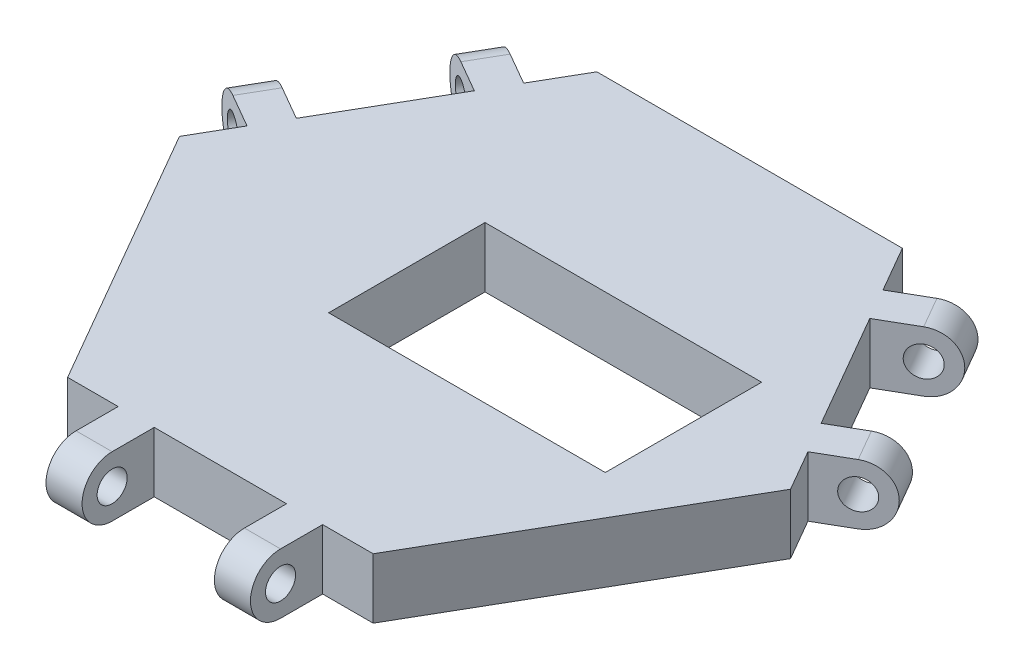
from build123d import *

# Parameters (mm, degrees)
BOSS_EXTRUDE1_DEPTH     = 5
BOSS_EXTRUDE2_START     = 5.5
SKETCH2_R               = 1.25
BOSS_EXTRUDE2_DEPTH     = 3
CIRPATTERN1_START       = -8.29907709
CIRPATTERN1_OUTLINE_R   = 1.25
CIRPATTERN1_DEPTH       = 3
CIRPATTERN1_START_2     = 5.754432
CIRPATTERN1_2_OUTLINE_R = 1.25
CIRPATTERN1_2_DEPTH     = 3
CIRPATTERN1_START_3     = -8.588604314
CIRPATTERN1_3_OUTLINE_R = 1.25
CIRPATTERN1_3_DEPTH     = 3
CIRPATTERN1_START_4     = 5.245568
CIRPATTERN1_4_OUTLINE_R = 1.25
CIRPATTERN1_4_DEPTH     = 3
CUT_EXTRUDE1_REACH      = 42.122
SKETCH3_W               = 23
SKETCH3_H               = 13


# Read off the part's stored shape, not the designer's step: CirPattern1
with BuildPart() as part:
    # Sketch1 → Boss-Extrude1 (new body)
    with BuildSketch(Plane(origin=(0, 0, 0), x_dir=(1, 0, 0), z_dir=(0, 1, 0))):
        Polygon((25.403411844, 0), (12.701705922, 22), (-12.701705922, 22), (-25.403411844, 0), (-12.701705922, -22), (12.701705922, -22), align=None)
    extrude(amount=BOSS_EXTRUDE1_DEPTH)

    # Sketch2 → Boss-Extrude2 (add)
    with BuildSketch(Plane(origin=(0, 0, 0), x_dir=(0, 0, -1), z_dir=(1, 0, 0)).offset(BOSS_EXTRUDE2_START)):
        with BuildLine():
            Line((-22, 5), (-25.5, 5))
            ThreePointArc((-25.5, 5), (-28, 2.5), (-25.5, 0))
            Line((-25.5, 0), (-22, 0))
            Line((-22, 0), (-22, 5))
        make_face()
        with Locations((-25.5, 2.5)):
            Circle(SKETCH2_R, mode=Mode.SUBTRACT)
    boss_extrude2 = extrude(amount=BOSS_EXTRUDE2_DEPTH)

    # Mirror1: Boss-Extrude2 across plane
    add(boss_extrude2.mirror(Plane(origin=(0, 0, 0), x_dir=(0, 0, 1), z_dir=(1, 0, 0))))

    # CirPattern1 outline → CirPattern1 (add)
    with BuildSketch(Plane(origin=(0, 0, 0), x_dir=(0.8660254037844362, 0, -0.5000000000000042), z_dir=(0.5000000000000042, 0, 0.8660254037844363)).offset(CIRPATTERN1_START)):
        with BuildLine():
            Line((25.281685655, 5), (22, 5))
            Line((22, 5), (22, 0))
            Line((22, 0), (25.281685655, 0))
            ThreePointArc((25.281685655, 0), (27.781685655, 2.5), (25.281685655, 5))
        make_face()
        with Locations((25.281685655, 2.5)):
            Circle(CIRPATTERN1_OUTLINE_R, mode=Mode.SUBTRACT)
    extrude(amount=CIRPATTERN1_DEPTH)

    # CirPattern1 2 outline → CirPattern1 2 (add)
    with BuildSketch(Plane(origin=(0, 0, 0), x_dir=(0.8660254037844362, 0, -0.5000000000000042), z_dir=(0.5000000000000042, 0, 0.8660254037844363)).offset(CIRPATTERN1_START_2)):
        with BuildLine():
            ThreePointArc((25.059310849, 0), (27.559310849, 2.5), (25.059310849, 5))
            Line((25.059310849, 5), (22, 5))
            Line((22, 5), (22, 0))
            Line((22, 0), (25.059310849, 0))
        make_face()
        with Locations((25.059310849, 2.5)):
            Circle(CIRPATTERN1_2_OUTLINE_R, mode=Mode.SUBTRACT)
    extrude(amount=CIRPATTERN1_2_DEPTH)

    # CirPattern1 3 outline → CirPattern1 3 (add)
    with BuildSketch(Plane(origin=(0, 0, 0), x_dir=(0.8660254037844431, 0, 0.4999999999999921), z_dir=(0.4999999999999921, 0, -0.8660254037844433)).offset(CIRPATTERN1_START_3)):
        with BuildLine():
            Line((-25.216838483, -5), (-22, -5))
            Line((-22, -5), (-22, 0))
            Line((-22, 0), (-25.216838483, 0))
            ThreePointArc((-25.216838483, 0), (-27.716838483, -2.5), (-25.216838483, -5))
        make_face()
        with Locations((-25.216838483, -2.5)):
            Circle(CIRPATTERN1_3_OUTLINE_R, mode=Mode.SUBTRACT)
    extrude(amount=CIRPATTERN1_3_DEPTH)

    # CirPattern1 4 outline → CirPattern1 4 (add)
    with BuildSketch(Plane(origin=(0, 0, 0), x_dir=(0.8660254037844431, 0, 0.4999999999999921), z_dir=(0.4999999999999921, 0, -0.8660254037844433)).offset(CIRPATTERN1_START_4)):
        with BuildLine():
            ThreePointArc((-25.059310849, 0), (-27.559310849, -2.5), (-25.059310849, -5))
            Line((-25.059310849, -5), (-22, -5))
            Line((-22, -5), (-22, 0))
            Line((-22, 0), (-25.059310849, 0))
        make_face()
        with Locations((-25.059310849, -2.5)):
            Circle(CIRPATTERN1_4_OUTLINE_R, mode=Mode.SUBTRACT)
    extrude(amount=CIRPATTERN1_4_DEPTH)

    # Sketch3 → Cut-Extrude1 (cut, up to next)
    with BuildSketch(Plane(origin=(0, 5, 0), x_dir=(1, 0, 0), z_dir=(0, 1, 0)), mode=Mode.PRIVATE) as cut_extrude1_sk1:
        with Locations((5, 0)):
            Rectangle(SKETCH3_W, SKETCH3_H)
    cut_extrude1_tool1 = extrude(cut_extrude1_sk1.sketch, amount=-CUT_EXTRUDE1_REACH, mode=Mode.PRIVATE) & part.part
    add(cut_extrude1_tool1.solids().sort_by_distance((5, 5, 0))[0], mode=Mode.SUBTRACT)


solid = part.part
